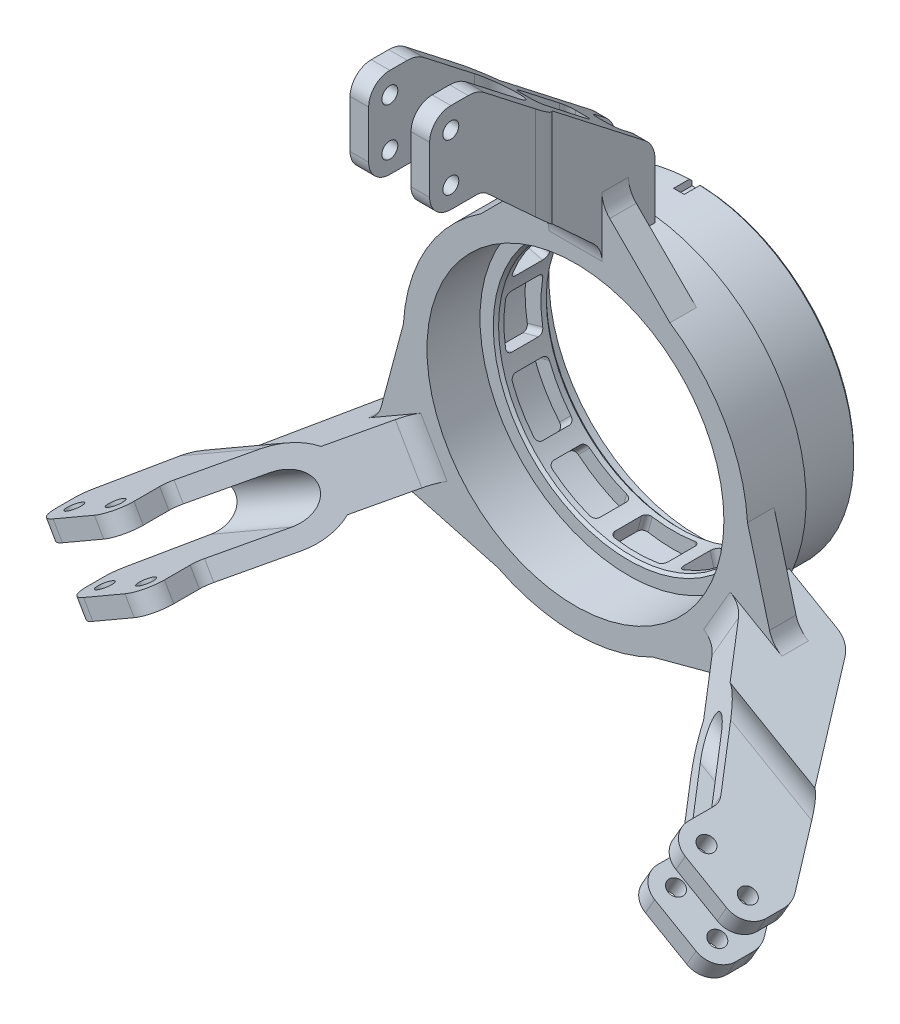
from build123d import *
from build123d.topology import SkipClean

# Parameters (mm, degrees)
EXTRUDE_START                    = -5
EXTRUDE_1_DEPTH                  = 5
EXTRUDE_START_2                  = -45
EXTRUDE_2_DEPTH                  = 50
SKETCH_4_R                       = 1.5
CUT_EXTRUDE_1_DEPTH              = 10
PATTERN_CIRCULAR_1_COUNT         = 3
SKETCH_5_R                       = 1.5
EXTRUDE_3_DEPTH                  = 7.5
CUT_EXTRUDE_2_DEPTH              = 109.042118048
PATTERN_CIRCULAR_2_COUNT         = 3
FILLET_1_R                       = 3
FILLET_2_R                       = 5
CUT_EXTRUDE_3_DEPTH              = 2.5
CUT_EXTRUDE_4_DEPTH              = 5
FILLET_3_R                       = 1.5
PATTERN_CIRCULAR_3_COUNT         = 3
FILLET_3_OF_PATTERN_CIRCULAR_3_R = 1.5
SKETCH_9_R                       = 32.5
SKETCH_9_R_2                     = 30
CUT_EXTRUDE_5_DEPTH              = 12
CHAMFER_1_SIZE                   = 0.5
CUT_EXTRUDE_6_DEPTH              = 7
FILLET_4_R                       = 1
CHAMFER_2_SIZE                   = 0.5
SKETCH_12_W                      = 2
SKETCH_12_H                      = 4.230652602
CUT_EXTRUDE_7_DEPTH              = 3.5


with BuildPart() as part:
    # 草图1 → 旋转1 (revolve)
    with BuildSketch(Plane(origin=(0, 0, 0), x_dir=(0, 0, -1), z_dir=(1, 0, 0)), mode=Mode.PRIVATE) as revolve_1_sk:
        Polygon((10, 28), (10, 25), (0, 25), (0, 28), (-10, 28), (-10, 32.5), (13, 32.5), (13, 28), align=None)
    revolve(revolve_1_sk.sketch.rotate(Axis((0, 0, 0), (0, 0, -1)), 90), axis=Axis((0, 0, 0), (0, 0, -1)))

    # 草图2 → 凸台-拉伸1 (add)
    with BuildSketch(Plane.XY.offset(10).offset(EXTRUDE_START)):
        with BuildLine():
            Line((-5, 75), (5, 75))
            Line((5, 75), (5, 40))
            Line((5, 40), (17.822928267, 27.177071733))
            ThreePointArc((17.822928267, 27.177071733), (0, 32.5), (-17.822928267, 27.177071733))
            Line((-17.822928267, 27.177071733), (-5, 40))
            Line((-5, 40), (-5, 75))
        make_face()
    extrude_1 = extrude(amount=EXTRUDE_1_DEPTH)

    # 草图3 → 凸台-拉伸2 (add)
    with BuildSketch(Plane(origin=(0, 0, 5), x_dir=(-1, 0, 0), z_dir=(0, 0, -1)).offset(EXTRUDE_START_2)):
        with BuildLine():
            Line((5, 40), (5, 27.549954628))
            ThreePointArc((5, 27.549954628), (0, 28), (-5, 27.549954628))
            Line((-5, 27.549954628), (-5, 40))
            Line((-5, 40), (-5, 75))
            Line((-5, 75), (5, 75))
            Line((5, 75), (5, 40))
        make_face()
    extrude_2 = extrude(amount=EXTRUDE_2_DEPTH)

    # 草图4 → 切除-拉伸1 (cut, symmetric)
    with BuildSketch(Plane(origin=(0, 0, 0), x_dir=(0, 0, -1), z_dir=(1, 0, 0))):
        with Locations(Location((-41, 60, 0), (0, 0, 90))):
            Circle(SKETCH_4_R)
        with Locations(Location((-41, 69, 0), (0, 0, 90))):
            Circle(SKETCH_4_R)
        with BuildLine():
            Line((-10, 27.549954628), (-50, 27.549954628))
            Line((-50, 27.549954628), (-50, 75))
            Line((-50, 75), (0, 75))
            Line((0, 75), (0, 45))
            Line((0, 45), (-36, 73))
            Line((-36, 73), (-41, 73))
            ThreePointArc((-41, 73), (-43.828427125, 71.828427125), (-45, 69))
            Line((-45, 69), (-45, 60))
            ThreePointArc((-45, 60), (-43.828427125, 57.171572875), (-41, 56))
            Line((-41, 56), (-35, 56))
            Line((-35, 56), (-10, 33))
            Line((-10, 33), (-10, 27.549954628))
        make_face()
    cut_extrude_1 = extrude(amount=CUT_EXTRUDE_1_DEPTH, both=True, mode=Mode.SUBTRACT)

    # 阵列(圆周)1: 凸台-拉伸1, 凸台-拉伸2, 切除-拉伸1 ×3 about axis
    pattern_circular_1_axis = Axis((0, 0, 0), (0, 0, 1))
    add([extrude_1.rotate(pattern_circular_1_axis, i * 360 / PATTERN_CIRCULAR_1_COUNT) for i in range(1, PATTERN_CIRCULAR_1_COUNT)])
    add([extrude_2.rotate(pattern_circular_1_axis, i * 360 / PATTERN_CIRCULAR_1_COUNT) for i in range(1, PATTERN_CIRCULAR_1_COUNT)])
    add([cut_extrude_1.rotate(pattern_circular_1_axis, i * 360 / PATTERN_CIRCULAR_1_COUNT) for i in range(1, PATTERN_CIRCULAR_1_COUNT)], mode=Mode.SUBTRACT)

    # 草图5 → 凸台-拉伸3 (add, symmetric)
    with SkipClean():  # the faces are left unmerged after this step: merging them gives an invalid solid
        with BuildSketch(Plane(origin=(0, 0, 0), x_dir=(0, 0, -1), z_dir=(1, 0, 0))):
            with BuildLine():
                Line((-10, 33), (-10, 52.777777778))
                Line((-10, 52.777777778), (-36, 73))
                Line((-36, 73), (-41, 73))
                ThreePointArc((-41, 73), (-43.828427125, 71.828427125), (-45, 69))
                Line((-45, 69), (-45, 60))
                ThreePointArc((-45, 60), (-43.828427125, 57.171572875), (-41, 56))
                Line((-41, 56), (-35, 56))
                Line((-35, 56), (-10, 33))
            make_face()
            with Locations((-41, 60)):
                Circle(SKETCH_5_R, mode=Mode.SUBTRACT)
            with Locations((-41, 69)):
                Circle(SKETCH_5_R, mode=Mode.SUBTRACT)
        extrude_3 = extrude(amount=EXTRUDE_3_DEPTH, both=True)

    # 草图6 → 切除-拉伸2 (cut, through all)
    with BuildSketch(Plane(origin=(0, 0, 0), x_dir=(1, 0, 0), z_dir=(0, 1, 0))):
        with BuildLine():
            Line((-4, -45), (4, -45))
            Line((4, -45), (4, -25))
            ThreePointArc((4, -25), (0, -21), (-4, -25))
            Line((-4, -25), (-4, -45))
        make_face()
        with BuildLine():
            Line((5, -10), (5, -19.409830056))
            ThreePointArc((5, -19.409830056), (6.846531969, -21.938137822), (7.5, -25))
            Line((7.5, -25), (7.5, -10))
            Line((7.5, -10), (5, -10))
        make_face()
        with BuildLine():
            Line((-5, -10), (-7.5, -10))
            Line((-7.5, -10), (-7.5, -25))
            ThreePointArc((-7.5, -25), (-6.846531969, -21.938137822), (-5, -19.409830056))
            Line((-5, -19.409830056), (-5, -10))
        make_face()
    cut_extrude_2 = extrude(amount=CUT_EXTRUDE_2_DEPTH, mode=Mode.SUBTRACT)

    # 阵列(圆周)2: 凸台-拉伸3, 切除-拉伸2 ×3 about axis
    pattern_circular_2_axis = Axis((0, 0, 0), (0, 0, 1))
    add([extrude_3.rotate(pattern_circular_2_axis, i * 360 / PATTERN_CIRCULAR_2_COUNT) for i in range(1, PATTERN_CIRCULAR_2_COUNT)])
    add([cut_extrude_2.rotate(pattern_circular_2_axis, i * 360 / PATTERN_CIRCULAR_2_COUNT) for i in range(1, PATTERN_CIRCULAR_2_COUNT)], mode=Mode.SUBTRACT)

    # 圆角1
    fillet_1_edges = [part.edges().sort_by_distance(p)[0] for p in [
        (51.372422612, -23.020353928, 35),
        (-45.622422612, -32.979646072, 35),
        (5.75, 56, 35),
        (45.622422612, -32.979646072, 35),
        (-51.372422612, -23.020353928, 35),
        (-5.75, 56, 35),
    ]]
    fillet(fillet_1_edges, radius=FILLET_1_R)

    # 圆角2
    fillet_2_edges = [part.edges().sort_by_distance(p)[0] for p in [
        (32.141016151, -24.330127019, 7.5),
        (37.141016151, -15.669872981, 7.5),
        (-37.141016151, -15.669872981, 7.5),
        (-32.141016151, -24.330127019, 7.5),
        (5, 40, 7.5),
        (-5, 40, 7.5),
        (-38.97114317, -22.5, 0),
        (38.97114317, -22.5, 0),
        (66.094854476, -31.520353928, 36),
        (-60.344854476, -41.479646072, 36),
        (5.75, 73, 36),
        (0, 33, 10),
        (0, 45, 0),
        (60.344854476, -41.479646072, 36),
        (28.578838325, -16.5, 10),
        (-66.094854476, -31.520353928, 36),
        (-28.578838325, -16.5, 10),
        (-5.75, 73, 36),
    ]]
    fillet(fillet_2_edges, radius=FILLET_2_R)

    # 草图7 → 切除-拉伸3 (cut, symmetric)
    with SkipClean():  # the faces are left unmerged after this step: merging them gives an invalid solid
        with BuildSketch(Plane(origin=(0, 0, 0), x_dir=(0, 0, -1), z_dir=(1, 0, 0))):
            Polygon((-19.409830056, 60.096534488), (-19.409830056, 47.092335732), (-9, 37.51529208), (-9, 52), align=None)
            with BuildLine():
                Line((0, 33), (-5, 33))
                Line((-5, 33), (-5, 48.888888889))
                Line((-5, 48.888888889), (-1.930296932, 46.501342059))
                ThreePointArc((-1.930296932, 46.501342059), (-0.508423699, 44.751338202), (0, 42.554580972))
                Line((0, 42.554580972), (0, 33))
            make_face()
        cut_extrude_3 = extrude(amount=CUT_EXTRUDE_3_DEPTH, both=True, mode=Mode.SUBTRACT)

    # 草图8 → 切除-拉伸4 (cut)
    with BuildSketch(Plane(origin=(0, 0, 0), x_dir=(-1, 0, 0), z_dir=(0, 0, -1))):
        with BuildLine():
            Line((2.5, 33), (-2.5, 33))
            Line((-2.5, 33), (-2.5, 32.403703492))
            ThreePointArc((-2.5, 32.403703492), (0, 32.5), (2.5, 32.403703492))
            Line((2.5, 32.403703492), (2.5, 33))
        make_face()
    cut_extrude_4 = extrude(amount=-CUT_EXTRUDE_4_DEPTH, mode=Mode.SUBTRACT)

    # 圆角3
    fillet_3_edges = [part.edges().sort_by_distance(p)[0] for p in [
        (-2.5, 44.75764604, 9),
        (-2.5, 53.59443511, 19.409830056),
        (2.5, 53.59443511, 19.409830056),
        (2.5, 44.75764604, 9),
        (-2.5, 40.944444444, 5),
        (2.5, 40.944444444, 5),
    ]]
    fillet(fillet_3_edges, radius=FILLET_3_R)

    # 阵列(圆周)3: 切除-拉伸3, 切除-拉伸4 ×3 about axis
    pattern_circular_3_axis = Axis((0, 0, 0), (0, 0, 1))
    add([cut_extrude_3.rotate(pattern_circular_3_axis, i * 360 / PATTERN_CIRCULAR_3_COUNT) for i in range(1, PATTERN_CIRCULAR_3_COUNT)], mode=Mode.SUBTRACT)
    add([cut_extrude_4.rotate(pattern_circular_3_axis, i * 360 / PATTERN_CIRCULAR_3_COUNT) for i in range(1, PATTERN_CIRCULAR_3_COUNT)], mode=Mode.SUBTRACT)

    # 圆角3 of 阵列(圆周)3
    fillet_3_of_pattern_circular_3_edges = [part.edges().sort_by_distance(p)[0] for p in [
        (-37.511258484, -24.54388653, 9),
        (-45.164142307, -28.962281065, 19.409830056),
        (-47.664142307, -24.632154046, 19.409830056),
        (-40.011258484, -20.213759511, 9),
        (-34.208929033, -22.637285732, 5),
        (-36.708929033, -18.307158713, 5),
        (40.011258484, -20.213759511, 9),
        (47.664142307, -24.632154046, 19.409830056),
        (45.164142307, -28.962281065, 19.409830056),
        (37.511258484, -24.54388653, 9),
        (36.708929033, -18.307158713, 5),
        (34.208929033, -22.637285732, 5),
    ]]
    fillet(fillet_3_of_pattern_circular_3_edges, radius=FILLET_3_OF_PATTERN_CIRCULAR_3_R)

    # 草图9 → 切除-拉伸5 (cut)
    with BuildSketch(Plane(origin=(0, 0, -13), x_dir=(-1, 0, 0), z_dir=(0, 0, -1))):
        with Locations(Location((0, 0, 0), (0, 0, 176.742835848))):
            Circle(SKETCH_9_R)
        Circle(SKETCH_9_R_2, mode=Mode.SUBTRACT)
    extrude(amount=-CUT_EXTRUDE_5_DEPTH, mode=Mode.SUBTRACT)

    # 倒角1
    chamfer_1_edges = [part.edges().sort_by_distance(p)[0] for p in [
        (30, 0, -13),
    ]]
    chamfer(chamfer_1_edges, length=CHAMFER_1_SIZE)

    # 草图11 → 切除-拉伸6 (cut)
    with BuildSketch(Plane.XY.offset(-1.5)):
        with BuildLine():
            Line((5.00993003, 24.492868372), (5.787638072, 27.395314299))
            ThreePointArc((5.787638072, 27.395314299), (0, 28), (-5.787638072, 27.395314299))
            Line((-5.787638072, 27.395314299), (-5.00993003, 24.492868372))
            ThreePointArc((-5.00993003, 24.492868372), (0, 25), (5.00993003, 24.492868372))
        make_face()
        with BuildLine():
            Line((16.585160863, 18.706481207), (18.709898748, 20.831219092))
            ThreePointArc((18.709898748, 20.831219092), (14, 24.248711306), (8.685415551, 26.618857164))
            Line((8.685415551, 26.618857164), (7.907707509, 23.716411237))
            ThreePointArc((7.907707509, 23.716411237), (12.5, 21.650635095), (16.585160863, 18.706481207))
        make_face()
        with BuildLine():
            Line((23.716411237, 7.907707509), (26.618857164, 8.685415551))
            ThreePointArc((26.618857164, 8.685415551), (24.248711306, 14), (20.831219092, 18.709898748))
            Line((20.831219092, 18.709898748), (18.706481207, 16.585160863))
            ThreePointArc((18.706481207, 16.585160863), (21.650635095, 12.5), (23.716411237, 7.907707509))
        make_face()
        with BuildLine():
            Line((24.492868372, -5.00993003), (27.395314299, -5.787638072))
            ThreePointArc((27.395314299, -5.787638072), (28, 0), (27.395314299, 5.787638072))
            Line((27.395314299, 5.787638072), (24.492868372, 5.00993003))
            ThreePointArc((24.492868372, 5.00993003), (25, 0), (24.492868372, -5.00993003))
        make_face()
        with BuildLine():
            Line((18.706481207, -16.585160863), (20.831219092, -18.709898748))
            ThreePointArc((20.831219092, -18.709898748), (24.248711306, -14), (26.618857164, -8.685415551))
            Line((26.618857164, -8.685415551), (23.716411237, -7.907707509))
            ThreePointArc((23.716411237, -7.907707509), (21.650635095, -12.5), (18.706481207, -16.585160863))
        make_face()
        with BuildLine():
            Line((7.907707509, -23.716411237), (8.685415551, -26.618857164))
            ThreePointArc((8.685415551, -26.618857164), (14, -24.248711306), (18.709898748, -20.831219092))
            Line((18.709898748, -20.831219092), (16.585160863, -18.706481207))
            ThreePointArc((16.585160863, -18.706481207), (12.5, -21.650635095), (7.907707509, -23.716411237))
        make_face()
        with BuildLine():
            Line((-5.00993003, -24.492868372), (-5.787638072, -27.395314299))
            ThreePointArc((-5.787638072, -27.395314299), (0, -28), (5.787638072, -27.395314299))
            Line((5.787638072, -27.395314299), (5.00993003, -24.492868372))
            ThreePointArc((5.00993003, -24.492868372), (0, -25), (-5.00993003, -24.492868372))
        make_face()
        with BuildLine():
            Line((-16.585160863, -18.706481207), (-18.709898748, -20.831219092))
            ThreePointArc((-18.709898748, -20.831219092), (-14, -24.248711306), (-8.685415551, -26.618857164))
            Line((-8.685415551, -26.618857164), (-7.907707509, -23.716411237))
            ThreePointArc((-7.907707509, -23.716411237), (-12.5, -21.650635095), (-16.585160863, -18.706481207))
        make_face()
        with BuildLine():
            Line((-23.716411237, -7.907707509), (-26.618857164, -8.685415551))
            ThreePointArc((-26.618857164, -8.685415551), (-24.248711306, -14), (-20.831219092, -18.709898748))
            Line((-20.831219092, -18.709898748), (-18.706481207, -16.585160863))
            ThreePointArc((-18.706481207, -16.585160863), (-21.650635095, -12.5), (-23.716411237, -7.907707509))
        make_face()
        with BuildLine():
            Line((-24.492868372, 5.00993003), (-27.395314299, 5.787638072))
            ThreePointArc((-27.395314299, 5.787638072), (-28, 0), (-27.395314299, -5.787638072))
            Line((-27.395314299, -5.787638072), (-24.492868372, -5.00993003))
            ThreePointArc((-24.492868372, -5.00993003), (-25, 0), (-24.492868372, 5.00993003))
        make_face()
        with BuildLine():
            Line((-18.706481207, 16.585160863), (-20.831219092, 18.709898748))
            ThreePointArc((-20.831219092, 18.709898748), (-24.248711306, 14), (-26.618857164, 8.685415551))
            Line((-26.618857164, 8.685415551), (-23.716411237, 7.907707509))
            ThreePointArc((-23.716411237, 7.907707509), (-21.650635095, 12.5), (-18.706481207, 16.585160863))
        make_face()
        with BuildLine():
            Line((-7.907707509, 23.716411237), (-8.685415551, 26.618857164))
            ThreePointArc((-8.685415551, 26.618857164), (-14, 24.248711306), (-18.709898748, 20.831219092))
            Line((-18.709898748, 20.831219092), (-16.585160863, 18.706481207))
            ThreePointArc((-16.585160863, 18.706481207), (-12.5, 21.650635095), (-7.907707509, 23.716411237))
        make_face()
    extrude(amount=-CUT_EXTRUDE_6_DEPTH, mode=Mode.SUBTRACT)

    # 圆角4
    fillet_4_edges = [part.edges().sort_by_distance(p)[0] for p in [
        (-8.29656153, -25.1676342, -8.5),
        (-17.647529806, -19.768850149, -8.5),
        (-17.647529806, -19.768850149, -1.5),
        (-8.29656153, -25.1676342, -1.5),
        (-19.768850149, -17.647529806, -8.5),
        (-25.1676342, -8.29656153, -8.5),
        (-25.1676342, -8.29656153, -1.5),
        (-19.768850149, -17.647529806, -1.5),
        (5.398784051, -25.944091336, -8.5),
        (-5.398784051, -25.944091336, -8.5),
        (-5.398784051, -25.944091336, -1.5),
        (5.398784051, -25.944091336, -1.5),
        (17.647529806, -19.768850149, -8.5),
        (8.29656153, -25.1676342, -8.5),
        (8.29656153, -25.1676342, -1.5),
        (17.647529806, -19.768850149, -1.5),
        (25.1676342, -8.29656153, -8.5),
        (19.768850149, -17.647529806, -8.5),
        (19.768850149, -17.647529806, -1.5),
        (25.1676342, -8.29656153, -1.5),
        (25.944091336, 5.398784051, -8.5),
        (25.944091336, -5.398784051, -8.5),
        (25.944091336, -5.398784051, -1.5),
        (25.944091336, 5.398784051, -1.5),
        (19.768850149, 17.647529806, -8.5),
        (25.1676342, 8.29656153, -8.5),
        (25.1676342, 8.29656153, -1.5),
        (19.768850149, 17.647529806, -1.5),
        (-5.398784051, 25.944091336, -8.5),
        (5.398784051, 25.944091336, -8.5),
        (5.398784051, 25.944091336, -1.5),
        (-5.398784051, 25.944091336, -1.5),
        (-17.647529806, 19.768850149, -8.5),
        (-8.29656153, 25.1676342, -8.5),
        (-8.29656153, 25.1676342, -1.5),
        (-17.647529806, 19.768850149, -1.5),
        (-25.1676342, 8.29656153, -8.5),
        (-19.768850149, 17.647529806, -8.5),
        (-19.768850149, 17.647529806, -1.5),
        (-25.1676342, 8.29656153, -1.5),
        (-25.944091336, -5.398784051, -8.5),
        (-25.944091336, 5.398784051, -8.5),
        (-25.944091336, 5.398784051, -1.5),
        (-25.944091336, -5.398784051, -1.5),
        (8.29656153, 25.1676342, -8.5),
        (17.647529806, 19.768850149, -8.5),
        (17.647529806, 19.768850149, -1.5),
        (8.29656153, 25.1676342, -1.5),
    ]]
    fillet(fillet_4_edges, radius=FILLET_4_R)

    # 倒角2
    chamfer_2_edges = [part.edges().sort_by_distance(p)[0] for p in [
        (-25, 0, 0),
        (-25, 0, -10),
    ]]
    chamfer(chamfer_2_edges, length=CHAMFER_2_SIZE)

    # 草图12 → 切除-拉伸7 (cut)
    with BuildSketch(Plane(origin=(0, 0, -13), x_dir=(-1, 0, 0), z_dir=(0, 0, -1))):
        with Locations((0, 30.773643287)):
            Rectangle(SKETCH_12_W, SKETCH_12_H)
    extrude(amount=-CUT_EXTRUDE_7_DEPTH, mode=Mode.SUBTRACT)


solid = part.part
